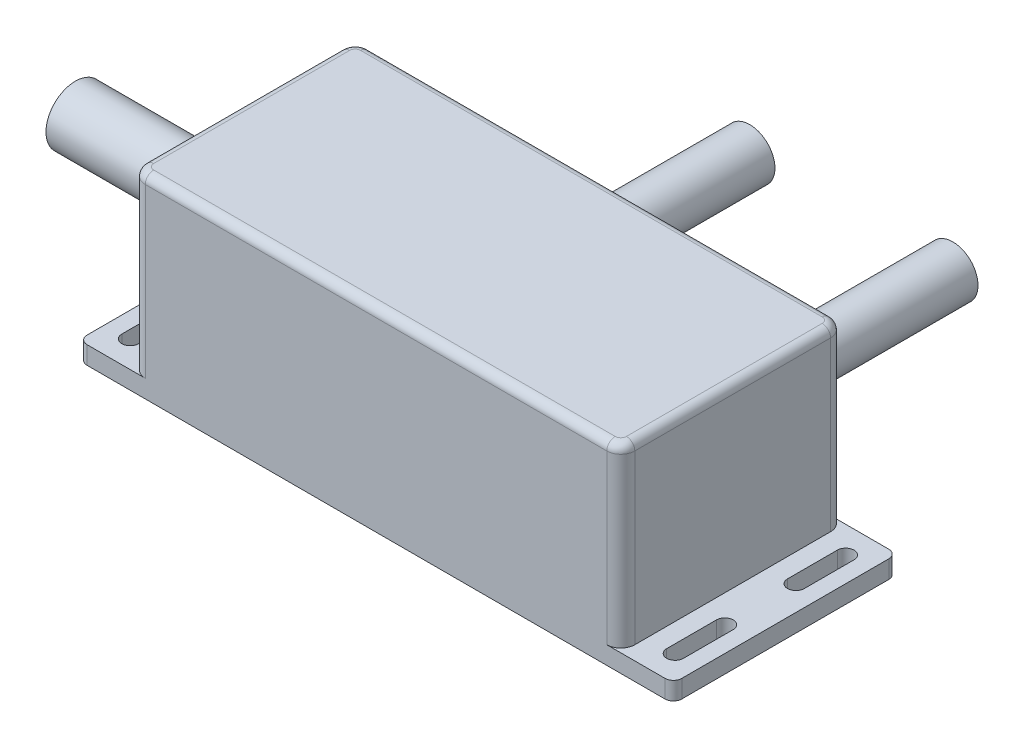
from build123d import *

# Parameters (mm, degrees)
AUFSATZ_LINEAR_AUSTRAGEN1_DEPTH = 6.4
SKIZZE2_W                       = 175
SKIZZE2_H                       = 80
AUFSATZ_LINEAR_AUSTRAGEN2_DEPTH = 63
VERRUNDUNG1_R                   = 5
VERRUNDUNG2_R                   = 3
SKIZZE3_R                       = 9
AUFSATZ_LINEAR_AUSTRAGEN3_DEPTH = 70
SKIZZE4_R                       = 10.5
AUFSATZ_LINEAR_AUSTRAGEN4_DEPTH = 60


with BuildPart() as part:
    # Skizze1 → Aufsatz-Linear austragen1 (new body)
    with BuildSketch(Plane(origin=(0, 0, 0), x_dir=(1, 0, 0), z_dir=(0, 1, 0))):
        with BuildLine():
            Line((-106.3, -37), (-106.3, 37))
            ThreePointArc((-106.3, 37), (-105.421320344, 39.121320344), (-103.3, 40))
            Line((-103.3, 40), (103.3, 40))
            ThreePointArc((103.3, 40), (105.421320344, 39.121320344), (106.3, 37))
            Line((106.3, 37), (106.3, -37))
            ThreePointArc((106.3, -37), (105.421320344, -39.121320344), (103.3, -40))
            Line((103.3, -40), (-103.3, -40))
            ThreePointArc((-103.3, -40), (-105.421320344, -39.121320344), (-106.3, -37))
        make_face()
        with BuildLine():
            Line((-94.4, 30.5), (-94.4, 12.7))
            ThreePointArc((-94.4, 12.7), (-97.4, 9.7), (-100.4, 12.7))
            Line((-100.4, 12.7), (-100.4, 30.5))
            ThreePointArc((-100.4, 30.5), (-97.4, 33.5), (-94.4, 30.5))
        make_face(mode=Mode.SUBTRACT)
        with BuildLine():
            Line((-94.4, -30.5), (-94.4, -12.7))
            ThreePointArc((-94.4, -12.7), (-97.4, -9.7), (-100.4, -12.7))
            Line((-100.4, -12.7), (-100.4, -30.5))
            ThreePointArc((-100.4, -30.5), (-97.4, -33.5), (-94.4, -30.5))
        make_face(mode=Mode.SUBTRACT)
        with BuildLine():
            Line((94.4, 30.5), (94.4, 12.7))
            ThreePointArc((94.4, 12.7), (97.4, 9.7), (100.4, 12.7))
            Line((100.4, 12.7), (100.4, 30.5))
            ThreePointArc((100.4, 30.5), (97.4, 33.5), (94.4, 30.5))
        make_face(mode=Mode.SUBTRACT)
        with BuildLine():
            Line((94.4, -30.5), (94.4, -12.7))
            ThreePointArc((94.4, -12.7), (97.4, -9.7), (100.4, -12.7))
            Line((100.4, -12.7), (100.4, -30.5))
            ThreePointArc((100.4, -30.5), (97.4, -33.5), (94.4, -30.5))
        make_face(mode=Mode.SUBTRACT)
    extrude(amount=AUFSATZ_LINEAR_AUSTRAGEN1_DEPTH)

    # Skizze2 → Aufsatz-Linear austragen2 (add)
    with BuildSketch(Plane(origin=(0, 6.4, 0), x_dir=(1, 0, 0), z_dir=(0, 1, 0))):
        Rectangle(SKIZZE2_W, SKIZZE2_H)
    extrude(amount=AUFSATZ_LINEAR_AUSTRAGEN2_DEPTH)

    # Verrundung1
    verrundung1_edges = [part.edges().sort_by_distance(p)[0] for p in [
        (87.5, 37.9, -40),
        (-87.5, 37.9, -40),
        (-87.5, 37.9, 40),
        (87.5, 37.9, 40),
    ]]
    fillet(verrundung1_edges, radius=VERRUNDUNG1_R)

    # Verrundung2
    verrundung2_edges = [part.edges().sort_by_distance(p)[0] for p in [
        (86.035533906, 69.4, -38.535533906),
        (87.5, 69.4, 0),
        (86.035533906, 69.4, 38.535533906),
        (0, 69.4, 40),
        (-86.035533906, 69.4, 38.535533906),
        (-87.5, 69.4, 0),
        (-86.035533906, 69.4, -38.535533906),
        (0, 69.4, -40),
    ]]
    fillet(verrundung2_edges, radius=VERRUNDUNG2_R)

    # Skizze3 → Aufsatz-Linear austragen3 (add)
    with BuildSketch(Plane(origin=(0, 0, -40), x_dir=(-1, 0, 0), z_dir=(0, 0, -1))):
        with Locations((-56.2, 34)):
            Circle(SKIZZE3_R)
        with Locations((16.4, 34)):
            Circle(SKIZZE3_R)
    extrude(amount=AUFSATZ_LINEAR_AUSTRAGEN3_DEPTH)

    # Skizze4 → Aufsatz-Linear austragen4 (add)
    with BuildSketch(Plane.ZY.offset(87.5)):
        with Locations((0, 35.4)):
            Circle(SKIZZE4_R)
    extrude(amount=AUFSATZ_LINEAR_AUSTRAGEN4_DEPTH)


solid = part.part
